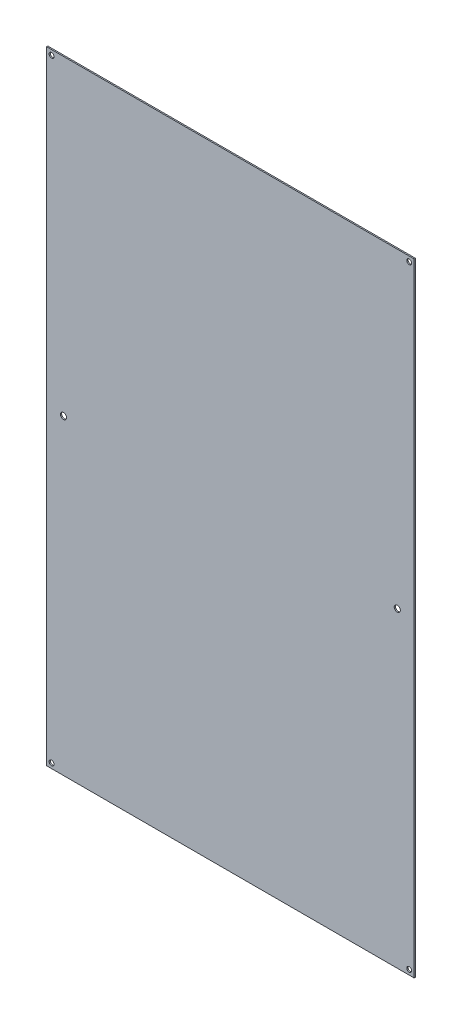
from build123d import *

# Parameters (mm, degrees)
SKETCH2_W           = 478
SKETCH2_H           = 809.900101531
SKETCH2_R           = 3.175
SKETCH2_R_2         = 3.96875
BOSS_EXTRUDE1_DEPTH = 1.6002


with BuildPart() as part:
    # Sketch2 → Boss-Extrude1 (new body)
    with BuildSketch(Plane.XY):
        with Locations((-130.152406859, 514.031343345)):
            Rectangle(SKETCH2_W, SKETCH2_H)
        with Locations((-362.710206859, 115.522426029)):
            Circle(SKETCH2_R, mode=Mode.SUBTRACT)
        with Locations((102.405393141, 912.54036211)):
            Circle(SKETCH2_R, mode=Mode.SUBTRACT)
        with Locations((-362.710206859, 912.54036211)):
            Circle(SKETCH2_R, mode=Mode.SUBTRACT)
        with Locations((102.405393141, 115.522426029)):
            Circle(SKETCH2_R, mode=Mode.SUBTRACT)
        with Locations((86.893613141, 514.031343345)):
            Circle(SKETCH2_R_2, mode=Mode.SUBTRACT)
        with Locations((-347.198426859, 514.031343345)):
            Circle(SKETCH2_R_2, mode=Mode.SUBTRACT)
    extrude(amount=BOSS_EXTRUDE1_DEPTH)


solid = part.part
